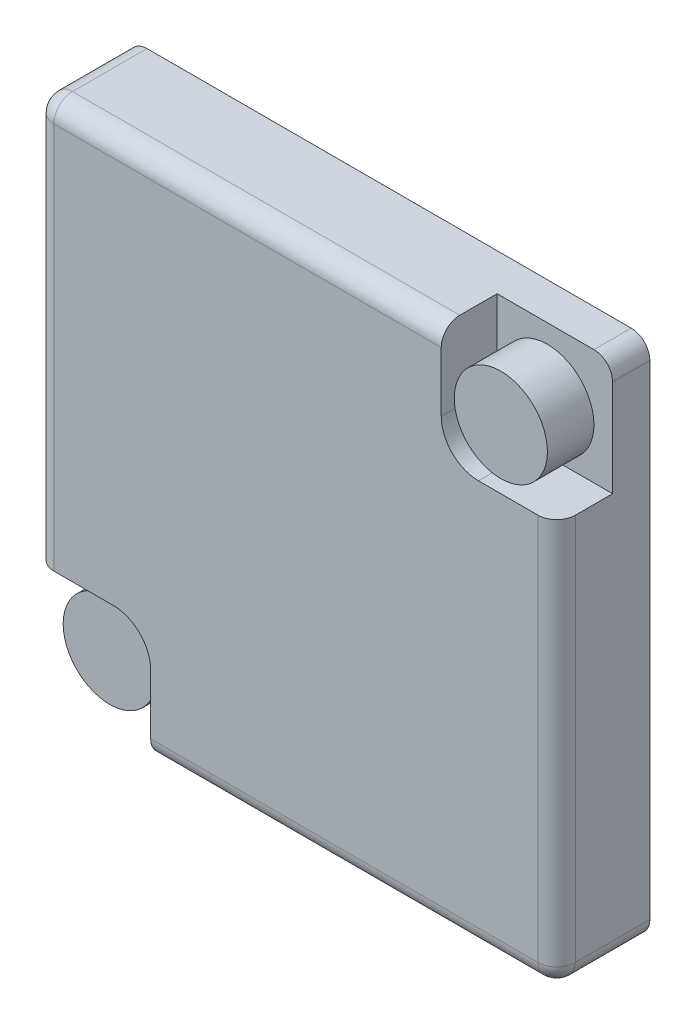
from build123d import *

# Parameters (mm, degrees)
COVER_SKETCH_W         = 28
COVER_SKETCH_H         = 28
COVER_DEPTH            = 5
COVER_ROUNDS_R         = 1
COVER_SCREW_CUTS_DEPTH = 3
COVER_SCREW_SKETCH_R   = 2.5
COVER_SCREW_DEPTH      = 2.5
COVER_SCREW_PAT_COUNT  = 2


with BuildPart() as part:
    # Threads_Sketch → Threads (revolve)
    with BuildSketch(Plane(origin=(0, 0, 0), x_dir=(1, 0, 0), z_dir=(0, 1, 0))):
        Polygon((0, 4), (-4.832923141, 4), (-4.895076859, 2), (0, 2), align=None)
    revolve(axis=Axis((0, 0, -35.350515464), (0, 0, 1)))

    # Cover_Sketch → Cover (add)
    with BuildSketch(Plane.XY):
        Rectangle(COVER_SKETCH_W, COVER_SKETCH_H)
    extrude(amount=-COVER_DEPTH)

    # Cover Rounds
    cover_rounds_edges = [part.edges().sort_by_distance(p)[0] for p in [
        (0, 14, 0),
        (14, 0, 0),
        (14, 14, -2.5),
        (14, -14, -2.5),
        (0, -14, 0),
        (-14, -14, -2.5),
        (-14, 0, 0),
        (-14, 14, -2.5),
    ]]
    fillet(cover_rounds_edges, radius=COVER_ROUNDS_R)

    # Cover Screw Cuts_Sketch → Cover Screw Cuts (cut)
    with BuildSketch(Plane.XY):
        with BuildLine():
            Line((14, 14), (7.8, 14))
            Line((7.8, 14), (7.8, 9.8))
            ThreePointArc((7.8, 9.8), (8.385786438, 8.385786438), (9.8, 7.8))
            Line((9.8, 7.8), (14, 7.8))
            Line((14, 7.8), (14, 14))
        make_face()
    cover_screw_cuts = extrude(amount=-COVER_SCREW_CUTS_DEPTH, mode=Mode.SUBTRACT)

    # Cover Screw_Sketch → Cover Screw (add)
    with BuildSketch(Plane.XY.offset(-3)):
        with Locations((10.5, 10.5)):
            Circle(COVER_SCREW_SKETCH_R)
    cover_screw = extrude(amount=COVER_SCREW_DEPTH)

    # Cover Screw Pat: Cover Screw Cuts, Cover Screw ×2 about axis
    cover_screw_pat_axis = Axis((0, 0, -35.350515464), (0, 0, 1))
    add([cover_screw_cuts.rotate(cover_screw_pat_axis, i * 360 / COVER_SCREW_PAT_COUNT) for i in range(1, COVER_SCREW_PAT_COUNT)], mode=Mode.SUBTRACT)
    add([cover_screw.rotate(cover_screw_pat_axis, i * 360 / COVER_SCREW_PAT_COUNT) for i in range(1, COVER_SCREW_PAT_COUNT)])


solid = part.part
